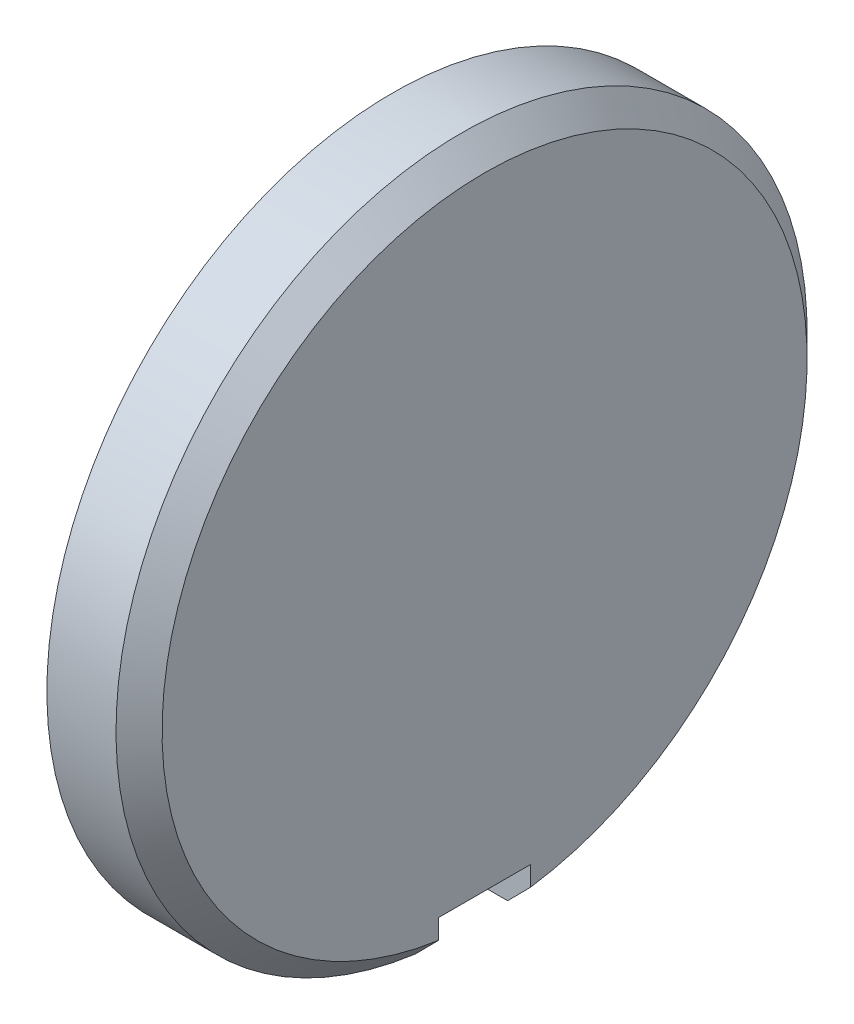
from build123d import *

# Parameters (mm, degrees)
BOSS_EXTRUDE1_START = -55.2
SKETCH2_W           = 1.28
SKETCH2_H           = 0.8
BOSS_EXTRUDE1_DEPTH = 6.4
BOSS_EXTRUDE2_START = -52.4
SKETCH3_W           = 1.28
SKETCH3_H           = 6.4
BOSS_EXTRUDE2_DEPTH = 0.8
BOSS_EXTRUDE3_START = -52.8
SKETCH4_W           = 1.8
SKETCH4_H           = 0.9
BOSS_EXTRUDE3_DEPTH = 1.6


with BuildPart() as part:
    # Sketch1 → Revolve1 (revolve)
    with BuildSketch(Plane.XY.offset(-52)):
        Polygon((58.2, 20.3), (59.4, 20.3), (59.4, 18), (61, 18), (61, 23.6), (60.6, 24), (59.4, 24), (59.4, 21), (58.2, 21), align=None)
    revolve(axis=Axis((53.2, 18, -52), (1, 0, 0)))


with BuildPart() as body_2:
    # Sketch2 → Boss-Extrude1 (new body)
    with BuildSketch(Plane.XY.offset(BOSS_EXTRUDE1_START)):
        with Locations((58.74, 18)):
            Rectangle(SKETCH2_W, SKETCH2_H)
    extrude(amount=BOSS_EXTRUDE1_DEPTH)


with BuildPart() as part_1:
    add(part.part)

    # Combine1: cut body 2
    add(body_2.part, mode=Mode.SUBTRACT)


with BuildPart() as body_2_2:
    # Sketch3 → Boss-Extrude2 (new body)
    with BuildSketch(Plane.XY.offset(BOSS_EXTRUDE2_START)):
        with Locations((58.74, 18)):
            Rectangle(SKETCH3_W, SKETCH3_H)
    extrude(amount=BOSS_EXTRUDE2_DEPTH)


with BuildPart() as part_2:
    add(part_1.part)

    # Combine2: cut body 2 2
    add(body_2_2.part, mode=Mode.SUBTRACT)


with BuildPart() as body_2_3:
    # Sketch4 → Boss-Extrude3 (new body)
    with BuildSketch(Plane.XY.offset(BOSS_EXTRUDE3_START)):
        with Locations((60.2, 12.35)):
            Rectangle(SKETCH4_W, SKETCH4_H)
    extrude(amount=BOSS_EXTRUDE3_DEPTH)


with BuildPart() as part_3:
    add(part_2.part)

    # Combine3: cut body 2 3
    add(body_2_3.part, mode=Mode.SUBTRACT)


solid = part_3.part
